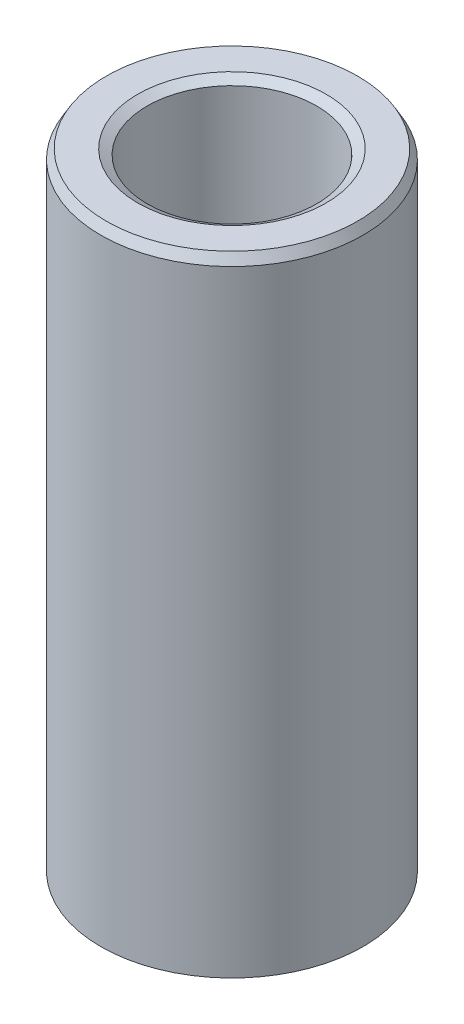
from build123d import *
from OCP.BRepFilletAPI import BRepFilletAPI_MakeChamfer

# Parameters (mm, degrees)
SKETCH1_R           = 32.5
BOSS_EXTRUDE1_DEPTH = 156.379065142
SKETCH2_R           = 21.016515402
CUT_EXTRUDE1_DEPTH  = 163.993595011
CHAMFER1_SIZE       = 2.338955413
CHAMFER1_SIZE2      = 1.350396537


with BuildPart() as part:
    # Sketch1 → Boss-Extrude1 (new body)
    with BuildSketch(Plane(origin=(0, 0, 0), x_dir=(1, 0, 0), z_dir=(0, 1, 0))):
        Circle(SKETCH1_R)
    extrude(amount=BOSS_EXTRUDE1_DEPTH)

    # Sketch2 → Cut-Extrude1 (cut, through all)
    with BuildSketch(Plane(origin=(0, 0, 0), x_dir=(1, 0, 0), z_dir=(0, 1, 0))):
        Circle(SKETCH2_R)
    extrude(amount=CUT_EXTRUDE1_DEPTH, mode=Mode.SUBTRACT)

    # Chamfer1: one chamfer whose edges measure the first distance from different faces: ONE call of the kernel's chamfer builder (chamfer() names one face for all edges)
    chamfer1_edges_1 = [part.edges().sort_by_distance(p)[0] for p in [
        (-21.016515402, 156.379065142, 0),
    ]]
    chamfer1_side_1 = [part.faces().sort_by_distance(p)[0] for p in [
        (-31.580761184, 156.379065142, 0),
    ]]
    chamfer1_edges_2 = [part.edges().sort_by_distance(p)[0] for p in [
        (-21.016515402, 0, 0),
    ]]
    chamfer1_side_2 = [part.faces().sort_by_distance(p)[0] for p in [
        (-21.016515402, 78.189532571, 0),
    ]]
    chamfer1_edges_3 = [part.edges().sort_by_distance(p)[0] for p in [
        (-32.5, 0, 0),
    ]]
    chamfer1_side_3 = [part.faces().sort_by_distance(p)[0] for p in [
        (-31.580761184, 0, 0),
    ]]
    chamfer1_edges_4 = [part.edges().sort_by_distance(p)[0] for p in [
        (-32.5, 156.379065142, 0),
    ]]
    chamfer1_side_4 = [part.faces().sort_by_distance(p)[0] for p in [
        (-32.5, 78.189532571, 0),
    ]]
    chamfer1 = BRepFilletAPI_MakeChamfer(part.part.solid().wrapped)
    for e in chamfer1_edges_1:
        chamfer1.Add(CHAMFER1_SIZE, CHAMFER1_SIZE2, e.wrapped, chamfer1_side_1[0].wrapped)  # the first distance lies on this face
    for e in chamfer1_edges_2:
        chamfer1.Add(CHAMFER1_SIZE, CHAMFER1_SIZE2, e.wrapped, chamfer1_side_2[0].wrapped)  # the first distance lies on this face
    for e in chamfer1_edges_3:
        chamfer1.Add(CHAMFER1_SIZE, CHAMFER1_SIZE2, e.wrapped, chamfer1_side_3[0].wrapped)  # the first distance lies on this face
    for e in chamfer1_edges_4:
        chamfer1.Add(CHAMFER1_SIZE, CHAMFER1_SIZE2, e.wrapped, chamfer1_side_4[0].wrapped)  # the first distance lies on this face
    add(Compound.cast(chamfer1.Shape()), mode=Mode.REPLACE)


solid = part.part
